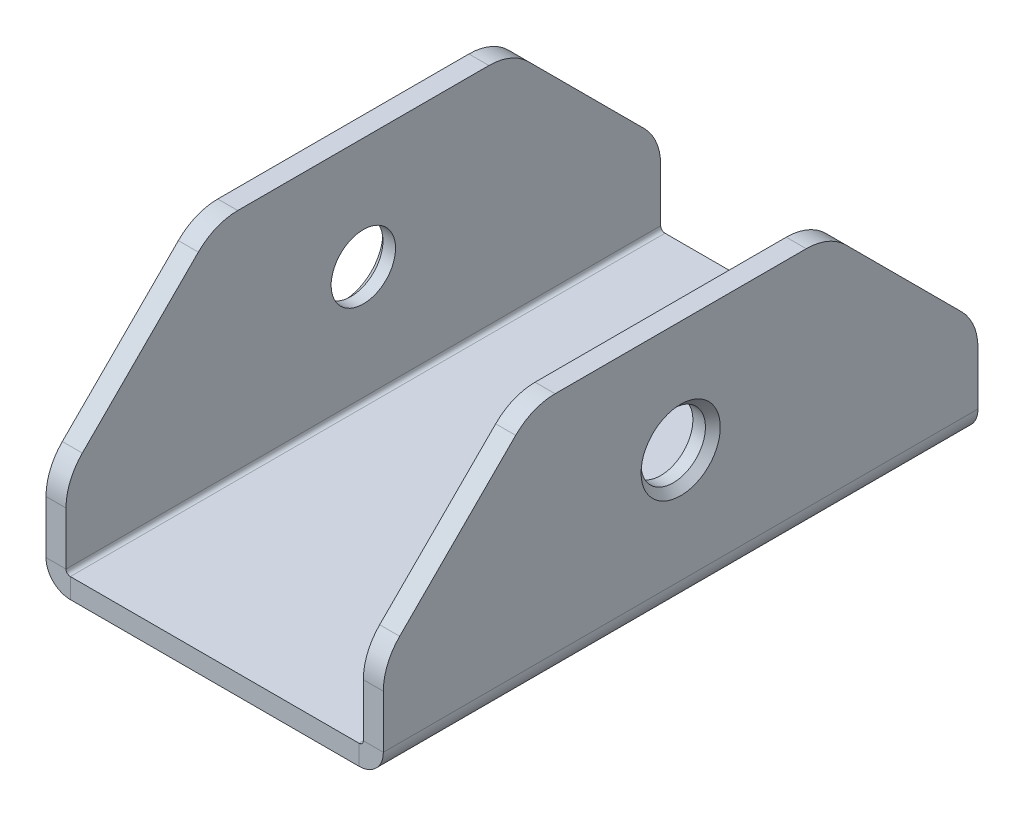
from build123d import *

# Parameters (mm, degrees)
BASE_FLANGE1_DEPTH        = 101.6
CHAMFER1_SIZE             = 25.4
FILLET1_R                 = 9.525
M10_CLEARANCE_HOLE1_D     = 11
M10_CLEARANCE_HOLE1_DEPTH = 57.658
M10_CLEARANCE_HOLE1_TIP   = 3.304733405
CHAMFER2_SIZE             = 1.27


# Sheet-metal steps are written as plain solids
with BuildPart() as part:
    # Sketch1 → Base-Flange1 (new body)
    with BuildSketch(Plane.XY):
        with BuildLine():
            Line((0, 39.116), (0, 0.7366))
            ThreePointArc((0, 0.7366), (0.215745145, 0.215745145), (0.7366, 0))
            Line((0.7366, 0), (50.0634, 0))
            ThreePointArc((50.0634, 0), (50.584254855, 0.215745145), (50.8, 0.7366))
            Line((50.8, 0.7366), (50.8, 39.116))
            Line((50.8, 39.116), (54.2163, 39.116))
            Line((54.2163, 39.116), (54.2163, 0.7366))
            ThreePointArc((54.2163, 0.7366), (52.999943752, -2.199943752), (50.0634, -3.4163))
            Line((50.0634, -3.4163), (0.7366, -3.4163))
            ThreePointArc((0.7366, -3.4163), (-2.199943752, -2.199943752), (-3.4163, 0.7366))
            Line((-3.4163, 0.7366), (-3.4163, 39.116))
            Line((-3.4163, 39.116), (0, 39.116))
        make_face()
    extrude(amount=BASE_FLANGE1_DEPTH)

    # Chamfer1
    chamfer1_edges = [part.edges().sort_by_distance(p)[0] for p in [
        (-1.70815, 39.116, 0),
        (52.50815, 39.116, 0),
        (-1.70815, 39.116, 101.6),
        (52.50815, 39.116, 101.6),
    ]]
    chamfer(chamfer1_edges, length=CHAMFER1_SIZE)

    # Fillet1
    fillet1_edges = [part.edges().sort_by_distance(p)[0] for p in [
        (52.50815, 13.716, 0),
        (52.50815, 39.116, 76.2),
        (52.50815, 39.116, 25.4),
        (52.50815, 13.716, 101.6),
        (-1.70815, 13.716, 0),
        (-1.70815, 39.116, 76.2),
        (-1.70815, 39.116, 25.4),
        (-1.70815, 13.716, 101.6),
    ]]
    fillet(fillet1_edges, radius=FILLET1_R)

    # M10 Clearance Hole1
    with Locations(Plane(origin=(54.2163, 0, 0), x_dir=(0, 0, -1), z_dir=(1, 0, 0))):
        with Locations((-50.8, 20.066)):
            Hole(M10_CLEARANCE_HOLE1_D / 2, depth=M10_CLEARANCE_HOLE1_DEPTH)
            with Locations((0, 0, -(M10_CLEARANCE_HOLE1_DEPTH + M10_CLEARANCE_HOLE1_TIP / 2))):  # 118° drill point
                Cone(0, M10_CLEARANCE_HOLE1_D / 2, M10_CLEARANCE_HOLE1_TIP, mode=Mode.SUBTRACT)

    # Chamfer2
    chamfer2_edges = [part.edges().sort_by_distance(p)[0] for p in [
        (-3.4163, 20.066, 45.3),
        (54.2163, 20.066, 45.3),
    ]]
    chamfer(chamfer2_edges, length=CHAMFER2_SIZE)


solid = part.part
